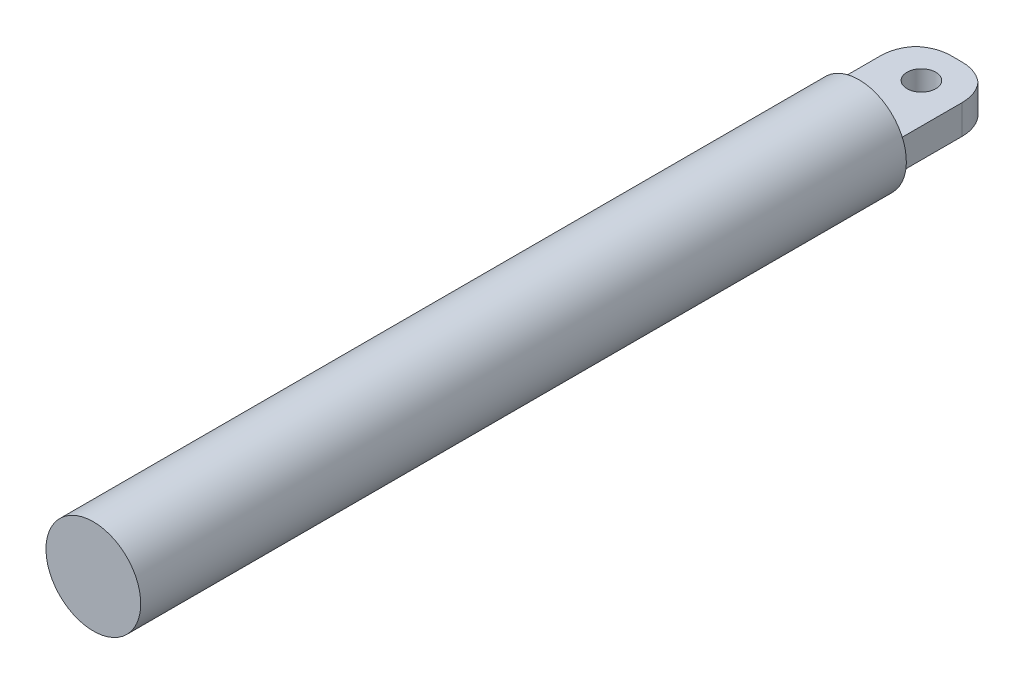
from build123d import *

# Parameters (mm, degrees)
SKETCH1_W           = 80
SKETCH1_H           = 4.95
SKETCH2_W           = 8.501628875
SKETCH2_H           = 3.058191312
BOSS_EXTRUDE1_DEPTH = 50
CHAMFER1_SIZE       = 2
FILLET1_R           = 4
HOLE1_START         = -3.599264013
HOLE1_OUTLINE_R     = 1.5
HOLE1_DEPTH         = 3.058191312
SCALE1_SCALE        = 18.33


# Read off the part's stored shape, not the designer's step: Hole1
with BuildPart() as part:
    # Sketch1 → Revolve1 (revolve)
    with BuildSketch(Plane(origin=(0, 0, 0), x_dir=(0, 0, -1), z_dir=(1, 0, 0))):
        Rectangle(SKETCH1_W, SKETCH1_H)
    revolve(axis=Axis((0, -2.475, -40), (0, 0, 1)))

    # Sketch2 → Boss-Extrude1 (add)
    with BuildSketch(Plane.XY):
        with Locations((0.196159038, -2.070168357)):
            Rectangle(SKETCH2_W, SKETCH2_H)
    extrude(amount=-BOSS_EXTRUDE1_DEPTH)

    # Chamfer1
    chamfer1_edges = [part.edges().sort_by_distance(p)[0] for p in [
        (4.446973476, -2.070168357, -50),
        (-4.054655399, -2.070168357, -50),
    ]]
    chamfer(chamfer1_edges, length=CHAMFER1_SIZE)

    # Fillet1
    # the kernel refuses this fillet: 4 mm, written as the material it takes off along each edge
    with BuildSketch(Plane(origin=(-2.054655399, 3.601062923, -50), x_dir=(-0.7071067811865491, 0, 0.7071067811865459), z_dir=(0, -1, 0)), Plane(origin=(4.446973476, -7.741399637, -48), x_dir=(0, 0, 1), z_dir=(0, 1, 0)), Plane(origin=(-4.054655399, 3.601062923, -48), x_dir=(0, 0, 1), z_dir=(0, -1, 0))) as fillet1_piece_1:
        with BuildLine():
            CenterArc((FILLET1_R * 0.414213562373, -FILLET1_R), FILLET1_R, 90, 45)
            Line((-FILLET1_R * 0.292893218813, -FILLET1_R * 0.292893218813), (0, 0))
            Line((0, 0), (FILLET1_R * 0.414213562373, 0))
        make_face()
    extrude(amount=11.34246256, mode=Mode.SUBTRACT)
    with BuildSketch(Plane(origin=(2.446973476, -7.741399637, -50), x_dir=(-1, 0, 0), z_dir=(0, 1, 0))) as fillet1_piece_2:
        with BuildLine():
            CenterArc((FILLET1_R * 0.414213562373, FILLET1_R), FILLET1_R, 225, 45)
            Line((-FILLET1_R * 0.292893218813, FILLET1_R * 0.292893218813), (0, 0))
            Line((0, 0), (FILLET1_R * 0.414213562373, 0))
        make_face()
    extrude(amount=11.34246256, mode=Mode.SUBTRACT)

    # Hole1 outline → Hole1 (cut)
    with BuildSketch(Plane(origin=(0, 0, 0), x_dir=(1, 0, 0), z_dir=(0, 1, 0)).offset(HOLE1_START)):
        with Locations((0.316437215, 46.206035657)):
            Circle(HOLE1_OUTLINE_R)
    extrude(amount=HOLE1_DEPTH, mode=Mode.SUBTRACT)


with BuildPart() as part_1:
    # Scale1: scaled about (0.006416206, -2.460917228, -1.550485335)
    add(part.part.scale(SCALE1_SCALE).moved(Location((-0.11119285, 42.647695561, 26.869910856))))


solid = part_1.part
